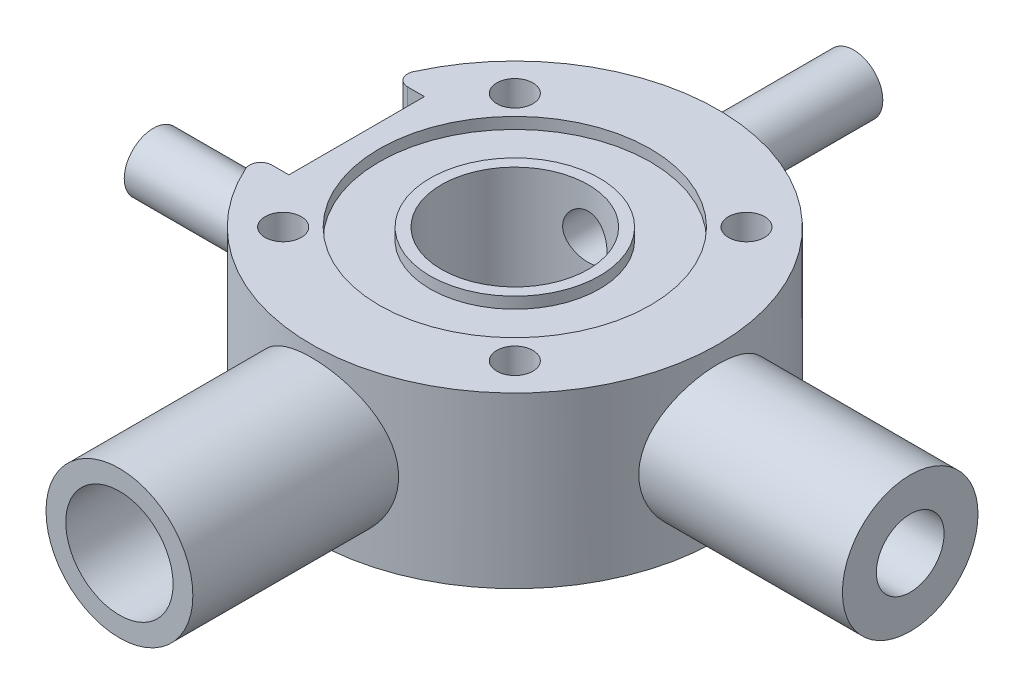
from build123d import *

# Parameters (mm, degrees)
SKETCH1_R         = 18
BODY_DEPTH        = 15
SKETCH2_R         = 12
SKETCH2_R_2       = 7.5
GASKET_DEPTH      = 1
SKETCH6_R         = 6
CE_PORT_DEPTH     = 35
SKETCH8_W         = 8
SKETCH8_H         = 12
SPE_DEPTH         = 6
SPE_FILLET_R      = 1
SKETCH9_R         = 6.5
RE_PORT_DEPTH     = 35
SKETCH10_R        = 4.75
RE_HOLE_DEPTH     = 35
SKETCH7_R         = 3
CE_HOLE_DEPTH     = 35
SKETCH11_R        = 1.6
BOLTS_DEPTH       = 35
SKETCH13_R        = 2.575
OUTLET_DEPTH      = 30
SKETCH4_R         = 6.5
CELL_VOL_DEPTH    = 13
OUTLET_H_R        = 1.963591437
OUTLET_HOLE_DEPTH = 30
SKETCH15_R        = 2.575
INLET_DEPTH       = 18
SKETCH16_R        = 1.575
INLET_HOLE_DEPTH  = 32


with BuildPart() as part:
    # Sketch1 → Body (new body)
    with BuildSketch(Plane(origin=(0, 0, 0), x_dir=(1, 0, 0), z_dir=(0, 1, 0))):
        with Locations(Location((0, 0, 0), (0, 0, 270))):
            Circle(SKETCH1_R)
    extrude(amount=BODY_DEPTH)

    # Sketch2 → Gasket (cut)
    with BuildSketch(Plane(origin=(0, 15, 0), x_dir=(1, 0, 0), z_dir=(0, 1, 0))):
        with Locations(Location((0, 0, 0), (0, 0, 270))):
            Circle(SKETCH2_R)
        with Locations(Location((0, 0, 0), (0, 0, 270))):
            Circle(SKETCH2_R_2, mode=Mode.SUBTRACT)
    extrude(amount=-GASKET_DEPTH, mode=Mode.SUBTRACT)

    # Sketch6 → CE_port (add)
    with BuildSketch(Plane(origin=(0, 0, 0), x_dir=(0, 0, -1), z_dir=(1, 0, 0))):
        with Locations(Location((0, 7.5, 0), (0, 0, 180))):
            Circle(SKETCH6_R)
    extrude(amount=CE_PORT_DEPTH)

    # Sketch8 → SPE (cut)
    with BuildSketch(Plane(origin=(0, 15, 0), x_dir=(1, 0, 0), z_dir=(0, 1, 0))):
        with Locations((-18, 0)):
            Rectangle(SKETCH8_W, SKETCH8_H)
    extrude(amount=-SPE_DEPTH, mode=Mode.SUBTRACT)

    # SPE_Fillet
    # the kernel refuses this fillet: 1 mm, written as the material it takes off along each edge
    with BuildSketch(Plane(origin=(0, 9, 0), x_dir=(-0.8875777915854841, 0, 0.4606578598962953), z_dir=(0.4606578598962953, 0, 0.8875777915854841))) as spe_fillet_piece_1_section:
        with BuildLine():
            CenterArc((18 - SPE_FILLET_R, SPE_FILLET_R), SPE_FILLET_R, 270, 90)
            Line((18 - SPE_FILLET_R, 0), (18, 0))
            Line((18, 0), (18, SPE_FILLET_R))
        make_face()
    spe_fillet_piece_1 = revolve(axis=Axis((0, 9, 0), (0, -1, 0)), revolution_arc=54.859132299, mode=Mode.PRIVATE)
    spe_fillet_piece_1 = split(spe_fillet_piece_1, bisect_by=Plane(origin=(-17.717440744, 8.717440744, 6), z_dir=(0, 0, -1)), keep=Keep.TOP, mode=Mode.PRIVATE)
    spe_fillet_piece_1 = split(spe_fillet_piece_1, bisect_by=Plane(origin=(-17.717440744, 8.717440744, -6), z_dir=(0, 0, 1)), keep=Keep.TOP, mode=Mode.PRIVATE)
    add(spe_fillet_piece_1, mode=Mode.SUBTRACT)
    with BuildSketch(Plane(origin=(-16.970562748, 18.803742657, -6), x_dir=(0.3728821950274604, 0, -0.9278786928427136), z_dir=(0, -1, 0))) as spe_fillet_piece_2:
        with BuildLine():
            CenterArc((1.479233256, 0.999106486), SPE_FILLET_R, 158.106520097, 114.315739171)
            Line((0.551354563, 1.371988681), (0, 0))
            ThreePointArc((0, 0), (0.760748531, -0.01608325), (1.521497063, 0))
        make_face()
    extrude(amount=9.803742657, mode=Mode.SUBTRACT)
    with BuildSketch(Plane(origin=(-16.970562748, 18.803742657, 6), x_dir=(0.37288219502746, 0, 0.9278786928427138), z_dir=(0, -1, 0))) as spe_fillet_piece_3:
        with BuildLine():
            CenterArc((1.479233256, -0.999106486), SPE_FILLET_R, 87.577740732, 114.315739171)
            Line((0.551354563, -1.371988681), (0, 0))
            ThreePointArc((0, 0), (0.760748531, 0.01608325), (1.521497063, 0))
        make_face()
    extrude(amount=9.803742657, mode=Mode.SUBTRACT)
    with BuildSketch(Plane(origin=(-16.970562748, 18.803742657, 6), x_dir=(0.37288219502746, 0, 0.9278786928427138), z_dir=(0, -1, 0))) as spe_fillet_piece_4a_section:
        with BuildLine():
            CenterArc((1.479233256, -0.999106486), SPE_FILLET_R, 87.577740732, 114.315739171)
            Line((0.551354563, -1.371988681), (0, 0))
            ThreePointArc((0, 0), (0.760748531, 0.01608325), (1.521497063, 0))
        make_face()
    spe_fillet_piece_4a = extrude(amount=13.607485314, mode=Mode.PRIVATE)
    spe_fillet_piece_4a = split(spe_fillet_piece_4a, bisect_by=Plane(origin=(-16.491409341, 9, 6.340012755), z_dir=(0, -1, 0)), keep=Keep.TOP, mode=Mode.PRIVATE)
    with BuildSketch(Plane(origin=(0, 9, 0), x_dir=(-0.8875777915854841, 0, 0.4606578598962953), z_dir=(0.4606578598962953, 0, 0.8875777915854841))) as spe_fillet_piece_4b_section:
        with BuildLine():
            CenterArc((18 - SPE_FILLET_R, SPE_FILLET_R), SPE_FILLET_R, 270, 90)
            Line((18 - SPE_FILLET_R, 0), (18, 0))
            Line((18, 0), (18, SPE_FILLET_R))
        make_face()
    spe_fillet_piece_4b = revolve(axis=Axis((0, 9, 0), (0, -1, 0)), revolution_arc=54.859132299, mode=Mode.PRIVATE)
    spe_fillet_piece_4b = split(spe_fillet_piece_4b, bisect_by=Plane(origin=(-16.286739391, 8.767935426, 6), z_dir=(0, 0, 1)), keep=Keep.TOP, mode=Mode.PRIVATE)
    spe_fillet_piece_4 = spe_fillet_piece_4a & spe_fillet_piece_4b
    add(spe_fillet_piece_4, mode=Mode.SUBTRACT)
    with BuildSketch(Plane(origin=(0, 9, 0), x_dir=(-0.8875777915854841, 0, 0.4606578598962953), z_dir=(0.4606578598962953, 0, 0.8875777915854841))) as spe_fillet_piece_5a_section:
        with BuildLine():
            CenterArc((18 - SPE_FILLET_R, SPE_FILLET_R), SPE_FILLET_R, 270, 90)
            Line((18 - SPE_FILLET_R, 0), (18, 0))
            Line((18, 0), (18, SPE_FILLET_R))
        make_face()
    spe_fillet_piece_5a = revolve(axis=Axis((0, 9, 0), (0, -1, 0)), revolution_arc=54.859132299, mode=Mode.PRIVATE)
    spe_fillet_piece_5a = split(spe_fillet_piece_5a, bisect_by=Plane(origin=(-16.286739653, 8.767935416, -6), z_dir=(0, 0, -1)), keep=Keep.TOP, mode=Mode.PRIVATE)
    with BuildSketch(Plane(origin=(-16.970562748, 18.803742657, -6), x_dir=(0.3728821950274604, 0, -0.9278786928427136), z_dir=(0, -1, 0))) as spe_fillet_piece_5b_section:
        with BuildLine():
            CenterArc((1.479233256, 0.999106486), SPE_FILLET_R, 158.106520097, 114.315739171)
            Line((0.551354563, 1.371988681), (0, 0))
            ThreePointArc((0, 0), (0.760748531, -0.01608325), (1.521497063, 0))
        make_face()
    spe_fillet_piece_5b = extrude(amount=13.607485314, mode=Mode.PRIVATE)
    spe_fillet_piece_5b = split(spe_fillet_piece_5b, bisect_by=Plane(origin=(-16.491409341, 9, -6.340012755), z_dir=(0, -1, 0)), keep=Keep.TOP, mode=Mode.PRIVATE)
    spe_fillet_piece_5 = spe_fillet_piece_5a & spe_fillet_piece_5b
    add(spe_fillet_piece_5, mode=Mode.SUBTRACT)

    # Sketch9 → RE_port (add)
    with BuildSketch(Plane.XY):
        with Locations(Location((0, 7.5, 0), (0, 0, 180))):
            Circle(SKETCH9_R)
    extrude(amount=RE_PORT_DEPTH)

    # Sketch10 → RE_hole (cut)
    with BuildSketch(Plane.XY.offset(35)):
        with Locations((0, 7.5)):
            Circle(SKETCH10_R)
    extrude(amount=-RE_HOLE_DEPTH, mode=Mode.SUBTRACT)

    # Sketch7 → CE_hole (cut)
    with BuildSketch(Plane(origin=(35, 0, 0), x_dir=(0, 0, -1), z_dir=(1, 0, 0))):
        with Locations((0, 7.5)):
            Circle(SKETCH7_R)
    extrude(amount=-CE_HOLE_DEPTH, mode=Mode.SUBTRACT)

    # Sketch11 → Bolts (cut)
    with BuildSketch(Plane(origin=(0, 15, 0), x_dir=(1, 0, 0), z_dir=(0, 1, 0))):
        with Locations(Location((-10.253048327, 10.253048327, 0), (0, 0, 270))):
            Circle(SKETCH11_R)
        with Locations(Location((10.253048327, 10.253048327, 0), (0, 0, 270))):
            Circle(SKETCH11_R)
        with Locations(Location((10.253048327, -10.253048327, 0), (0, 0, 270))):
            Circle(SKETCH11_R)
        with Locations(Location((-10.253048327, -10.253048327, 0), (0, 0, 270))):
            Circle(SKETCH11_R)
    extrude(amount=-BOLTS_DEPTH, mode=Mode.SUBTRACT)

    # Sketch13 → Outlet (add)
    with BuildSketch(Plane.XY):
        with Locations((0, 11)):
            Circle(SKETCH13_R)
    extrude(amount=-OUTLET_DEPTH)

    # Sketch4 → Cell_vol (cut)
    with BuildSketch(Plane(origin=(0, 15, 0), x_dir=(1, 0, 0), z_dir=(0, 1, 0))):
        with Locations(Location((0, 0, 0), (0, 0, 270))):
            Circle(SKETCH4_R)
    extrude(amount=-CELL_VOL_DEPTH, mode=Mode.SUBTRACT)

    # Outlet_h → Outlet_hole (cut)
    with BuildSketch(Plane(origin=(0, 0, -30), x_dir=(-1, 0, 0), z_dir=(0, 0, -1))):
        with Locations((0, 11)):
            Circle(OUTLET_H_R)
    extrude(amount=-OUTLET_HOLE_DEPTH, mode=Mode.SUBTRACT)

    # Sketch15 → Inlet (add)
    with BuildSketch(Plane.ZY.offset(14)):
        with Locations(Location((0, 4, 0), (0, 0, 180))):
            Circle(SKETCH15_R)
    extrude(amount=INLET_DEPTH)

    # Sketch16 → Inlet_hole (cut)
    with BuildSketch(Plane.ZY.offset(32)):
        with Locations((0, 4)):
            Circle(SKETCH16_R)
    extrude(amount=-INLET_HOLE_DEPTH, mode=Mode.SUBTRACT)


solid = part.part
